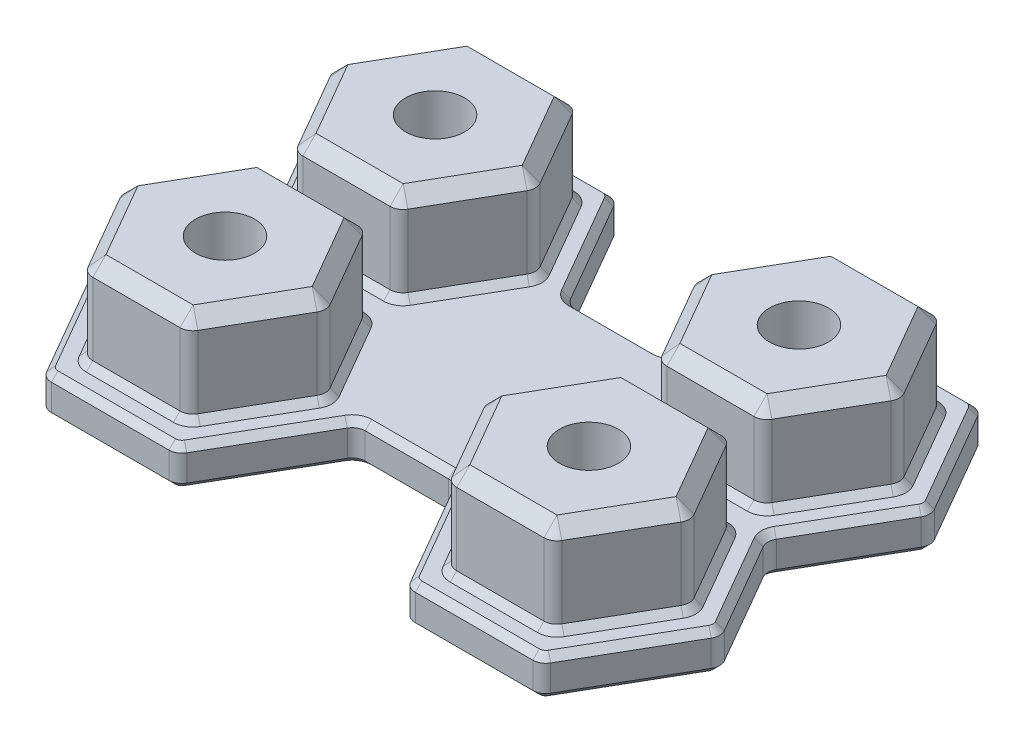
from build123d import *

# Parameters (mm, degrees)
BOSS_EXTRUDE1_DEPTH                      = 3
BOSS_EXTRUDE2_START                      = 3
BOSS_EXTRUDE2_DEPTH                      = 7
CHAMFER1_SIZE                            = 1
CHAMFER3_SIZE                            = 0.5
CBORE_FOR_M4_PAN_HEAD_SCREW1_D           = 4.5
CBORE_FOR_M4_PAN_HEAD_SCREW1_CBORE_D     = 9
CBORE_FOR_M4_PAN_HEAD_SCREW1_CBORE_DEPTH = 3.1


with BuildPart() as part:
    # Sketch1 → Boss-Extrude1 (new body)
    with BuildSketch(Plane(origin=(0, 0, 0), x_dir=(1, 0, 0), z_dir=(0, 1, 0))):
        with BuildLine():
            Line((9.814954576, 0.5), (5.34048999, 8.25))
            ThreePointArc((5.34048999, 8.25), (4.974464586, 8.616025404), (4.474464586, 8.75))
            Line((4.474464586, 8.75), (-4.474464586, 8.75))
            ThreePointArc((-4.474464586, 8.75), (-4.974464586, 8.616025404), (-5.34048999, 8.25))
            Line((-5.34048999, 8.25), (-9.814954576, 0.5))
            ThreePointArc((-9.814954576, 0.5), (-9.948929172, 0), (-9.814954576, -0.5))
            Line((-9.814954576, -0.5), (-5.773502692, -7.5))
            ThreePointArc((-5.773502692, -7.5), (-5.639528096, -8), (-5.773502692, -8.5))
            Line((-5.773502692, -8.5), (-9.814954576, -15.5))
            ThreePointArc((-9.814954576, -15.5), (-9.948929172, -16), (-9.814954576, -16.5))
            Line((-9.814954576, -16.5), (-5.34048999, -24.25))
            ThreePointArc((-5.34048999, -24.25), (-4.974464586, -24.616025404), (-4.474464586, -24.75))
            Line((-4.474464586, -24.75), (4.474464586, -24.75))
            ThreePointArc((4.474464586, -24.75), (4.974464586, -24.616025404), (5.34048999, -24.25))
            Line((5.34048999, -24.25), (9.814954576, -16.5))
            ThreePointArc((9.814954576, -16.5), (10.18097998, -16.133974596), (10.68097998, -16))
            Line((10.68097998, -16), (17.03902002, -16))
            ThreePointArc((17.03902002, -16), (17.53902002, -16.133974596), (17.905045424, -16.5))
            Line((17.905045424, -16.5), (22.37951001, -24.25))
            ThreePointArc((22.37951001, -24.25), (22.745535414, -24.616025404), (23.245535414, -24.75))
            Line((23.245535414, -24.75), (32.194464586, -24.75))
            ThreePointArc((32.194464586, -24.75), (32.694464586, -24.616025404), (33.06048999, -24.25))
            Line((33.06048999, -24.25), (37.534954576, -16.5))
            ThreePointArc((37.534954576, -16.5), (37.668929172, -16), (37.534954576, -15.5))
            Line((37.534954576, -15.5), (33.493502692, -8.5))
            ThreePointArc((33.493502692, -8.5), (33.359528096, -8), (33.493502692, -7.5))
            Line((33.493502692, -7.5), (37.534954576, -0.5))
            ThreePointArc((37.534954576, -0.5), (37.668929172, 0), (37.534954576, 0.5))
            Line((37.534954576, 0.5), (33.06048999, 8.25))
            ThreePointArc((33.06048999, 8.25), (32.694464586, 8.616025404), (32.194464586, 8.75))
            Line((32.194464586, 8.75), (23.245535414, 8.75))
            ThreePointArc((23.245535414, 8.75), (22.745535414, 8.616025404), (22.37951001, 8.25))
            Line((22.37951001, 8.25), (17.905045424, 0.5))
            ThreePointArc((17.905045424, 0.5), (17.53902002, 0.133974596), (17.03902002, 0))
            Line((17.03902002, 0), (10.68097998, 0))
            ThreePointArc((10.68097998, 0), (10.18097998, 0.133974596), (9.814954576, 0.5))
        make_face()
    extrude(amount=BOSS_EXTRUDE1_DEPTH)

    # Sketch1<3> → Boss-Extrude2 (add)
    with BuildSketch(Plane(origin=(0, 0, 0), x_dir=(1, 0, 0), z_dir=(0, 1, 0)).offset(BOSS_EXTRUDE2_START)):
        with BuildLine():
            Line((3.319764048, 6.75), (-3.319764048, 6.75))
            ThreePointArc((-3.319764048, 6.75), (-3.819764048, 6.616025404), (-4.185789452, 6.25))
            Line((-4.185789452, 6.25), (-7.505553499, 0.5))
            ThreePointArc((-7.505553499, 0.5), (-7.639528096, 0), (-7.505553499, -0.5))
            Line((-7.505553499, -0.5), (-4.185789452, -6.25))
            ThreePointArc((-4.185789452, -6.25), (-3.819764048, -6.616025404), (-3.319764048, -6.75))
            Line((-3.319764048, -6.75), (3.319764048, -6.75))
            ThreePointArc((3.319764048, -6.75), (3.819764048, -6.616025404), (4.185789452, -6.25))
            Line((4.185789452, -6.25), (7.505553499, -0.5))
            ThreePointArc((7.505553499, -0.5), (7.639528096, 0), (7.505553499, 0.5))
            Line((7.505553499, 0.5), (4.185789452, 6.25))
            ThreePointArc((4.185789452, 6.25), (3.819764048, 6.616025404), (3.319764048, 6.75))
        make_face()
        with BuildLine():
            Line((23.534210548, 6.25), (20.214446501, 0.5))
            ThreePointArc((20.214446501, 0.5), (20.080471904, 0), (20.214446501, -0.5))
            Line((20.214446501, -0.5), (23.534210548, -6.25))
            ThreePointArc((23.534210548, -6.25), (23.900235952, -6.616025404), (24.400235952, -6.75))
            Line((24.400235952, -6.75), (31.039764048, -6.75))
            ThreePointArc((31.039764048, -6.75), (31.539764048, -6.616025404), (31.905789452, -6.25))
            Line((31.905789452, -6.25), (35.225553499, -0.5))
            ThreePointArc((35.225553499, -0.5), (35.359528096, 0), (35.225553499, 0.5))
            Line((35.225553499, 0.5), (31.905789452, 6.25))
            ThreePointArc((31.905789452, 6.25), (31.539764048, 6.616025404), (31.039764048, 6.75))
            Line((31.039764048, 6.75), (24.400235952, 6.75))
            ThreePointArc((24.400235952, 6.75), (23.900235952, 6.616025404), (23.534210548, 6.25))
        make_face()
        with BuildLine():
            Line((31.039764048, -9.25), (24.400235952, -9.25))
            ThreePointArc((24.400235952, -9.25), (23.900235952, -9.383974596), (23.534210548, -9.75))
            Line((23.534210548, -9.75), (20.214446501, -15.5))
            ThreePointArc((20.214446501, -15.5), (20.080471904, -16), (20.214446501, -16.5))
            Line((20.214446501, -16.5), (23.534210548, -22.25))
            ThreePointArc((23.534210548, -22.25), (23.900235952, -22.616025404), (24.400235952, -22.75))
            Line((24.400235952, -22.75), (31.039764048, -22.75))
            ThreePointArc((31.039764048, -22.75), (31.539764048, -22.616025404), (31.905789452, -22.25))
            Line((31.905789452, -22.25), (35.225553499, -16.5))
            ThreePointArc((35.225553499, -16.5), (35.359528096, -16), (35.225553499, -15.5))
            Line((35.225553499, -15.5), (31.905789452, -9.75))
            ThreePointArc((31.905789452, -9.75), (31.539764048, -9.383974596), (31.039764048, -9.25))
        make_face()
        with BuildLine():
            Line((3.319764048, -9.25), (-3.319764048, -9.25))
            ThreePointArc((-3.319764048, -9.25), (-3.819764048, -9.383974596), (-4.185789452, -9.75))
            Line((-4.185789452, -9.75), (-7.505553499, -15.5))
            ThreePointArc((-7.505553499, -15.5), (-7.639528096, -16), (-7.505553499, -16.5))
            Line((-7.505553499, -16.5), (-4.185789452, -22.25))
            ThreePointArc((-4.185789452, -22.25), (-3.819764048, -22.616025404), (-3.319764048, -22.75))
            Line((-3.319764048, -22.75), (3.319764048, -22.75))
            ThreePointArc((3.319764048, -22.75), (3.819764048, -22.616025404), (4.185789452, -22.25))
            Line((4.185789452, -22.25), (7.505553499, -16.5))
            ThreePointArc((7.505553499, -16.5), (7.639528096, -16), (7.505553499, -15.5))
            Line((7.505553499, -15.5), (4.185789452, -9.75))
            ThreePointArc((4.185789452, -9.75), (3.819764048, -9.383974596), (3.319764048, -9.25))
        make_face()
    extrude(amount=BOSS_EXTRUDE2_DEPTH)

    # Chamfer1
    chamfer1_edges = [part.edges().sort_by_distance(p)[0] for p in [
        (0, 10, -6.75),
        (-5.845671476, 10, -3.375),
        (-5.845671476, 10, 3.375),
        (0, 10, 6.75),
        (5.845671476, 10, 3.375),
        (5.845671476, 10, -3.375),
        (3.819764048, 10, -6.616025404),
        (-3.819764048, 10, -6.616025404),
        (-7.639528096, 10, 0),
        (-3.819764048, 10, 6.616025404),
        (3.819764048, 10, 6.616025404),
        (7.639528096, 10, 0),
        (21.874328524, 10, -3.375),
        (21.874328524, 10, 3.375),
        (27.72, 10, 6.75),
        (33.565671476, 10, 3.375),
        (33.565671476, 10, -3.375),
        (27.72, 10, -6.75),
        (23.900235952, 10, -6.616025404),
        (20.080471904, 10, 0),
        (23.900235952, 10, 6.616025404),
        (31.539764048, 10, 6.616025404),
        (35.359528096, 10, 0),
        (31.539764048, 10, -6.616025404),
        (27.72, 10, 9.25),
        (21.874328524, 10, 12.625),
        (21.874328524, 10, 19.375),
        (27.72, 10, 22.75),
        (33.565671476, 10, 19.375),
        (33.565671476, 10, 12.625),
        (31.539764048, 10, 9.383974596),
        (23.900235952, 10, 9.383974596),
        (20.080471904, 10, 16),
        (23.900235952, 10, 22.616025404),
        (31.539764048, 10, 22.616025404),
        (35.359528096, 10, 16),
        (0, 10, 9.25),
        (-5.845671476, 10, 12.625),
        (-5.845671476, 10, 19.375),
        (0, 10, 22.75),
        (5.845671476, 10, 19.375),
        (5.845671476, 10, 12.625),
        (3.819764048, 10, 9.383974596),
        (-3.819764048, 10, 9.383974596),
        (-7.639528096, 10, 16),
        (-3.819764048, 10, 22.616025404),
        (3.819764048, 10, 22.616025404),
        (7.639528096, 10, 16),
    ]]
    chamfer(chamfer1_edges, length=CHAMFER1_SIZE - 0.0001)  # a hair under: the kernel refuses the full size

    # Chamfer3
    chamfer3_edges = [part.edges().sort_by_distance(p)[0] for p in [
        (-4.974464586, 3, -8.616025404),
        (32.694464586, 3, 24.616025404),
        (35.297722283, 3, 20.375),
        (37.668929172, 3, 16),
        (3.819764048, 3, -6.616025404),
        (-3.819764048, 3, -6.616025404),
        (35.514228634, 3, 12),
        (-7.639528096, 3, 0),
        (-3.819764048, 3, 6.616025404),
        (3.819764048, 3, 6.616025404),
        (7.639528096, 3, 0),
        (33.359528096, 3, 8),
        (5.845671476, 3, -3.375),
        (5.845671476, 3, 3.375),
        (0, 3, 6.75),
        (-5.845671476, 3, 3.375),
        (-5.845671476, 3, -3.375),
        (0, 3, -6.75),
        (35.514228634, 3, 4),
        (37.668929172, 3, 0),
        (35.297722283, 3, -4.375),
        (32.694464586, 3, -8.616025404),
        (23.900235952, 3, -6.616025404),
        (20.080471904, 3, 0),
        (23.900235952, 3, 6.616025404),
        (27.72, 3, -8.75),
        (31.539764048, 3, 6.616025404),
        (35.359528096, 3, 0),
        (31.539764048, 3, -6.616025404),
        (27.72, 3, -6.75),
        (33.565671476, 3, -3.375),
        (-7.577722283, 3, -4.375),
        (22.745535414, 3, -8.616025404),
        (33.565671476, 3, 3.375),
        (27.72, 3, 6.75),
        (21.874328524, 3, 3.375),
        (21.874328524, 3, -3.375),
        (20.142277717, 3, -4.375),
        (17.53902002, 3, -0.133974596),
        (13.86, 3, 0),
        (10.18097998, 3, -0.133974596),
        (31.539764048, 3, 9.383974596),
        (23.900235952, 3, 9.383974596),
        (20.080471904, 3, 16),
        (23.900235952, 3, 22.616025404),
        (7.577722283, 3, -4.375),
        (31.539764048, 3, 22.616025404),
        (35.359528096, 3, 16),
        (33.565671476, 3, 12.625),
        (33.565671476, 3, 19.375),
        (27.72, 3, 22.75),
        (21.874328524, 3, 19.375),
        (21.874328524, 3, 12.625),
        (4.974464586, 3, -8.616025404),
        (27.72, 3, 9.25),
        (-9.948929172, 3, 0),
        (3.819764048, 3, 9.383974596),
        (-3.819764048, 3, 9.383974596),
        (-7.639528096, 3, 16),
        (-3.819764048, 3, 22.616025404),
        (3.819764048, 3, 22.616025404),
        (7.639528096, 3, 16),
        (5.845671476, 3, 12.625),
        (5.845671476, 3, 19.375),
        (0, 3, 22.75),
        (-5.845671476, 3, 19.375),
        (-5.845671476, 3, 12.625),
        (0, 3, 9.25),
        (-7.794228634, 3, 4),
        (-5.639528096, 3, 8),
        (-7.794228634, 3, 12),
        (4.974464586, 0, -8.616025404),
        (7.577722283, 0, -4.375),
        (10.18097998, 0, -0.133974596),
        (13.86, 0, 0),
        (17.53902002, 0, -0.133974596),
        (-9.948929172, 3, 16),
        (20.142277717, 0, -4.375),
        (22.745535414, 0, -8.616025404),
        (27.72, 0, -8.75),
        (32.694464586, 0, -8.616025404),
        (35.297722283, 0, -4.375),
        (37.668929172, 0, 0),
        (35.514228634, 0, 4),
        (33.359528096, 0, 8),
        (35.514228634, 0, 12),
        (37.668929172, 0, 16),
        (-7.577722283, 3, 20.375),
        (35.297722283, 0, 20.375),
        (32.694464586, 0, 24.616025404),
        (27.72, 0, 24.75),
        (22.745535414, 0, 24.616025404),
        (20.142277717, 0, 20.375),
        (17.53902002, 0, 16.133974596),
        (13.86, 0, 16),
        (10.18097998, 0, 16.133974596),
        (7.577722283, 0, 20.375),
        (4.974464586, 0, 24.616025404),
        (0, 3, -8.75),
        (-4.974464586, 3, 24.616025404),
        (0, 0, 24.75),
        (-4.974464586, 0, 24.616025404),
        (-7.577722283, 0, 20.375),
        (-9.948929172, 0, 16),
        (-7.794228634, 0, 12),
        (-5.639528096, 0, 8),
        (-7.794228634, 0, 4),
        (-9.948929172, 0, 0),
        (-7.577722283, 0, -4.375),
        (-4.974464586, 0, -8.616025404),
        (0, 3, 24.75),
        (0, 0, -8.75),
        (4.974464586, 3, 24.616025404),
        (7.577722283, 3, 20.375),
        (10.18097998, 3, 16.133974596),
        (13.86, 3, 16),
        (17.53902002, 3, 16.133974596),
        (20.142277717, 3, 20.375),
        (22.745535414, 3, 24.616025404),
        (27.72, 3, 24.75),
    ]]
    chamfer(chamfer3_edges, length=CHAMFER3_SIZE)

    # CBORE for M4 Pan Head Screw1 (through all)
    with Locations(Plane.XZ):
        with Locations((0, 16), (0, 0), (27.72, 0), (27.72, 16)):
            CounterBoreHole(CBORE_FOR_M4_PAN_HEAD_SCREW1_D / 2, CBORE_FOR_M4_PAN_HEAD_SCREW1_CBORE_D / 2, CBORE_FOR_M4_PAN_HEAD_SCREW1_CBORE_DEPTH)


solid = part.part
